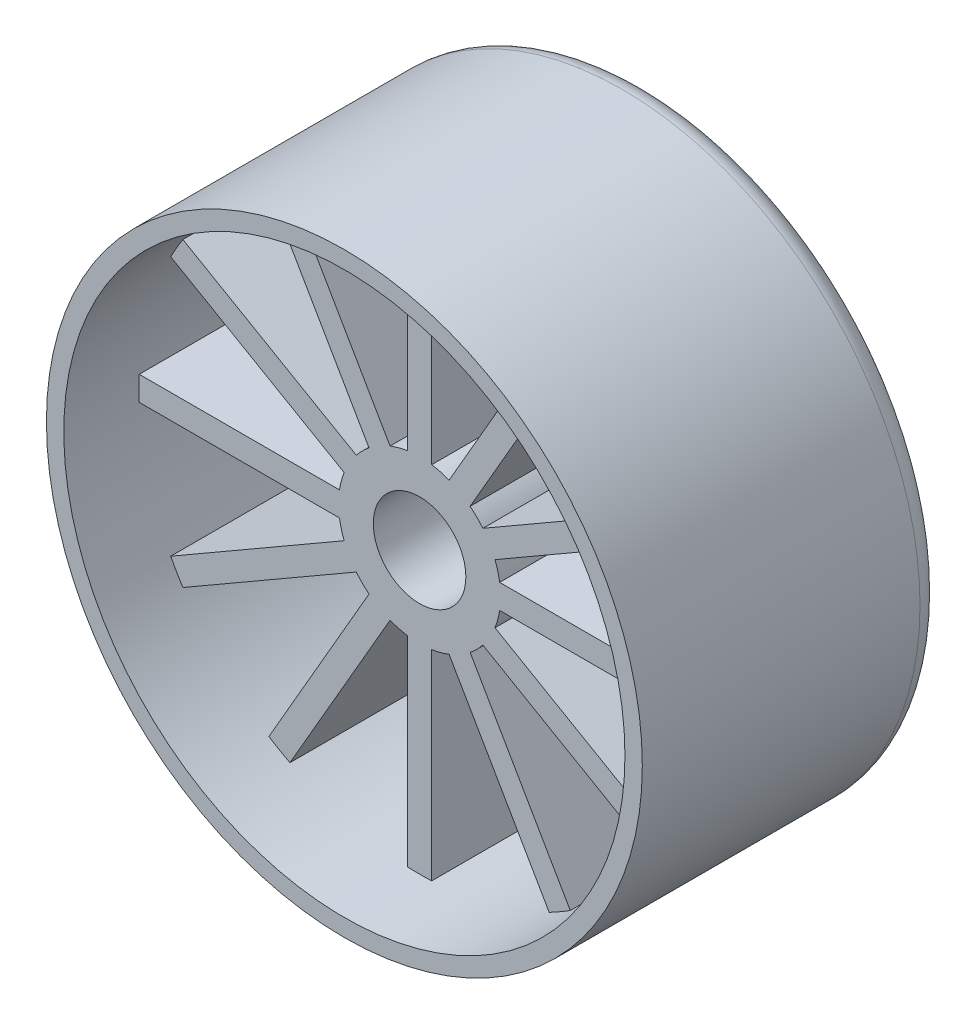
from build123d import *

# Parameters (mm, degrees)
SKICA1_R                 = 25.75
P_IDAT_VYSUNUT_M1_DEPTH  = 26
SKO_EPINA1_START         = 3.5
SKO_EPINA1_OUTLINE_R     = 24.25
SKO_EPINA1_DEPTH         = 22.5
SKICA2_R                 = 17
ODEBRAT_VYSUNUT_M1_DEPTH = 45.745111465
ZAOBLIT1_R               = 2
SKICA3_R                 = 4
P_IDAT_VYSUNUT_M2_DEPTH  = 16


# Read off the part's stored shape, not the designer's step: Skořepina1
with BuildPart() as part:
    # Skica1 → Přidat vysunutím1 (new body)
    with BuildSketch(Plane.XY):
        with Locations(Location((0, 0, 0), (0, 0, 180))):
            Circle(SKICA1_R)
    extrude(amount=P_IDAT_VYSUNUT_M1_DEPTH)

    # Skořepina1 outline → Skořepina1 (cut)
    with BuildSketch(Plane.XY.offset(SKO_EPINA1_START)):
        Circle(SKO_EPINA1_OUTLINE_R)
    extrude(amount=SKO_EPINA1_DEPTH, mode=Mode.SUBTRACT)

    # Skica2 → Odebrat vysunutím1 (cut, through all)
    with BuildSketch(Plane(origin=(0, 0, 0), x_dir=(-1, 0, 0), z_dir=(0, 0, -1))):
        Circle(SKICA2_R)
    extrude(amount=-ODEBRAT_VYSUNUT_M1_DEPTH, mode=Mode.SUBTRACT)

    # Zaoblit1
    zaoblit1_edges = [part.edges().sort_by_distance(p)[0] for p in [
        (25.75, 0, 0),
    ]]
    fillet(zaoblit1_edges, radius=ZAOBLIT1_R)

    # Skica3 → Přidat vysunutím2 (add)
    with BuildSketch(Plane.XY.offset(3.5)):
        with BuildLine():
            Line((-1.05, 24.227257377), (-1.05, 6.920801977))
            ThreePointArc((-1.05, 6.920801977), (-1.811733316, 6.761480784), (-2.551074314, 6.518590326))
            Line((-2.551074314, 6.518590326), (-11.204302014, 21.506420352))
            ThreePointArc((-11.204302014, 21.506420352), (-12.125, 21.001116042), (-13.022955362, 20.456420352))
            Line((-13.022955362, 20.456420352), (-4.369727662, 5.468590326))
            ThreePointArc((-4.369727662, 5.468590326), (-4.949747468, 4.949747468), (-5.468590326, 4.369727662))
            Line((-5.468590326, 4.369727662), (-20.456420352, 13.022955362))
            ThreePointArc((-20.456420352, 13.022955362), (-21.001116042, 12.125), (-21.506420352, 11.204302014))
            Line((-21.506420352, 11.204302014), (-6.518590326, 2.551074314))
            ThreePointArc((-6.518590326, 2.551074314), (-6.761480784, 1.811733316), (-6.920801977, 1.05))
            Line((-6.920801977, 1.05), (-24.227257377, 1.05))
            ThreePointArc((-24.227257377, 1.05), (-24.25, 0), (-24.227257377, -1.05))
            Line((-24.227257377, -1.05), (-6.920801977, -1.05))
            ThreePointArc((-6.920801977, -1.05), (-6.761480784, -1.811733316), (-6.518590326, -2.551074314))
            Line((-6.518590326, -2.551074314), (-21.506420352, -11.204302014))
            ThreePointArc((-21.506420352, -11.204302014), (-21.001116042, -12.125), (-20.456420352, -13.022955362))
            Line((-20.456420352, -13.022955362), (-5.468590326, -4.369727662))
            ThreePointArc((-5.468590326, -4.369727662), (-4.949747468, -4.949747468), (-4.369727662, -5.468590326))
            Line((-4.369727662, -5.468590326), (-13.022955362, -20.456420352))
            ThreePointArc((-13.022955362, -20.456420352), (-12.125, -21.001116042), (-11.204302014, -21.506420352))
            Line((-11.204302014, -21.506420352), (-2.551074314, -6.518590326))
            ThreePointArc((-2.551074314, -6.518590326), (-1.811733316, -6.761480784), (-1.05, -6.920801977))
            Line((-1.05, -6.920801977), (-1.05, -24.227257377))
            ThreePointArc((-1.05, -24.227257377), (0, -24.25), (1.05, -24.227257377))
            Line((1.05, -24.227257377), (1.05, -6.920801977))
            ThreePointArc((1.05, -6.920801977), (1.811733316, -6.761480784), (2.551074314, -6.518590326))
            Line((2.551074314, -6.518590326), (11.204302014, -21.506420352))
            ThreePointArc((11.204302014, -21.506420352), (12.125, -21.001116042), (13.022955362, -20.456420352))
            Line((13.022955362, -20.456420352), (4.369727662, -5.468590326))
            ThreePointArc((4.369727662, -5.468590326), (4.949747468, -4.949747468), (5.468590326, -4.369727662))
            Line((5.468590326, -4.369727662), (20.456420352, -13.022955362))
            ThreePointArc((20.456420352, -13.022955362), (21.001116042, -12.125), (21.506420352, -11.204302014))
            Line((21.506420352, -11.204302014), (6.518590326, -2.551074314))
            ThreePointArc((6.518590326, -2.551074314), (6.761480784, -1.811733316), (6.920801977, -1.05))
            Line((6.920801977, -1.05), (24.227257377, -1.05))
            ThreePointArc((24.227257377, -1.05), (24.25, 0), (24.227257377, 1.05))
            Line((24.227257377, 1.05), (6.920801977, 1.05))
            ThreePointArc((6.920801977, 1.05), (6.761480784, 1.811733316), (6.518590326, 2.551074314))
            Line((6.518590326, 2.551074314), (21.506420352, 11.204302014))
            ThreePointArc((21.506420352, 11.204302014), (21.001116042, 12.125), (20.456420352, 13.022955362))
            Line((20.456420352, 13.022955362), (5.468590326, 4.369727662))
            ThreePointArc((5.468590326, 4.369727662), (4.949747468, 4.949747468), (4.369727662, 5.468590326))
            Line((4.369727662, 5.468590326), (13.022955362, 20.456420352))
            ThreePointArc((13.022955362, 20.456420352), (12.125, 21.001116042), (11.204302014, 21.506420352))
            Line((11.204302014, 21.506420352), (2.551074314, 6.518590326))
            ThreePointArc((2.551074314, 6.518590326), (1.811733316, 6.761480784), (1.05, 6.920801977))
            Line((1.05, 6.920801977), (1.05, 24.227257377))
            ThreePointArc((1.05, 24.227257377), (0, 24.25), (-1.05, 24.227257377))
        make_face()
        Circle(SKICA3_R, mode=Mode.SUBTRACT)
    extrude(amount=P_IDAT_VYSUNUT_M2_DEPTH)


solid = part.part
